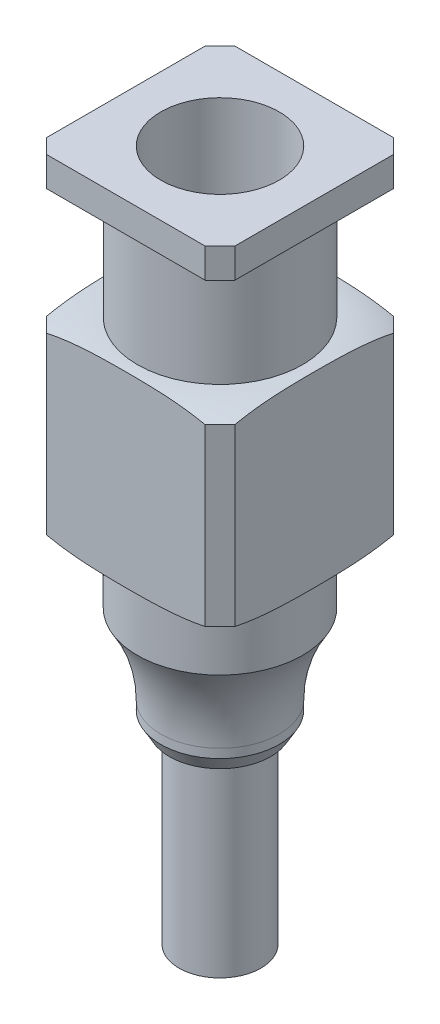
from build123d import *

# Parameters (mm, degrees)
FILLET1_R           = 5
CHAMFER2_SIZE       = 0.5
CHAMFER2_SIZE2      = 0.288675135
BOSS_EXTRUDE1_START = 12
SKETCH2_W           = 6.35
SKETCH2_H           = 6.35
BOSS_EXTRUDE1_DEPTH = 6.35
CHAMFER1_SIZE       = 0.5
BOSS_EXTRUDE3_DEPTH = 1
SKETCH5_R           = 2
CUT_EXTRUDE1_DEPTH  = 11
SKETCH6_R           = 1.0795
CUT_EXTRUDE2_DEPTH  = 14.140918966
CHAMFER3_SIZE       = 0.5


with BuildPart() as part:
    # Sketch1 → Revolve1 (revolve)
    with BuildSketch(Plane.XY, mode=Mode.PRIVATE) as revolve1_sk:
        Polygon((0, 0), (1.3843, 0), (1.3843, 6.35), (2, 6.35), (2, 9.85), (2.79, 9.85), (2.79, 23.35), (0, 23.35), align=None)
    revolve(revolve1_sk.sketch.rotate(Axis((0, 0, 0), (0, 1, 0)), 90), axis=Axis((0, 0, 0), (0, 1, 0)))

    # Fillet1
    # the kernel refuses this fillet: 5 mm, written as the material it adds along each edge
    with BuildSketch(Plane(origin=(0, 9.85, 0), x_dir=(0, 0, -1), z_dir=(1, 0, 0))) as fillet1_piece_1:
        with BuildLine():
            CenterArc((7, -2.697387625), FILLET1_R, 147.351921209, 32.648078791)
            Line((2.79, 0), (2, 0))
            Line((2, 0), (2, -2.697387625))
        make_face()
    revolve(axis=Axis((0, 9.85, 0), (0, 1, 0)))

    # Chamfer2
    chamfer2_edges = [part.edges().sort_by_distance(p)[0] for p in [
        (0, 6.35, 2),
    ]]
    chamfer2_side = [part.faces().sort_by_distance(p)[0] for p in [
        (0, 6.751306187, 2),
    ]]
    chamfer(chamfer2_edges, length=CHAMFER2_SIZE, length2=CHAMFER2_SIZE2, reference=chamfer2_side[0])

    # Sketch2 → Boss-Extrude1 (add)
    with BuildSketch(Plane(origin=(0, 0, 0), x_dir=(1, 0, 0), z_dir=(0, 1, 0)).offset(BOSS_EXTRUDE1_START)):
        Rectangle(SKETCH2_W, SKETCH2_H)
    extrude(amount=BOSS_EXTRUDE1_DEPTH)

    # Sketch3 → Cut-Revolve1 (revolve, cut)
    with BuildSketch(Plane.XY, mode=Mode.PRIVATE) as cut_revolve1_sk:
        with BuildLine():
            Line((-4.79, 17.85), (-4.79, 18.35))
            Line((-4.79, 18.35), (-2.79, 18.35))
            ThreePointArc((-2.79, 18.35), (-3.820776406, 18.223105626), (-4.79, 17.85))
        make_face()
        with BuildLine():
            Line((-4.79, 12.5), (-4.79, 12))
            Line((-4.79, 12), (-2.79, 12))
            ThreePointArc((-2.79, 12), (-3.820776406, 12.126894374), (-4.79, 12.5))
        make_face()
    revolve(cut_revolve1_sk.sketch.rotate(Axis((0, 23.35, 0), (0, -1, 0)), 270), axis=Axis((0, 23.35, 0), (0, -1, 0)), mode=Mode.SUBTRACT)

    # Chamfer1
    chamfer1_edges = [part.edges().sort_by_distance(p)[0] for p in [
        (-3.175, 15.175, -3.175),
        (3.175, 15.175, -3.175),
        (3.175, 15.175, 3.175),
        (-3.175, 15.175, 3.175),
    ]]
    chamfer(chamfer1_edges, length=CHAMFER1_SIZE)

    # Sketch4 → Boss-Extrude3 (add)
    with BuildSketch(Plane(origin=(0, 23.35, 0), x_dir=(1, 0, 0), z_dir=(0, 1, 0))):
        Polygon((-3.175, 2.675), (-3.175, -2.675), (-2.675, -3.175), (2.675, -3.175), (3.175, -2.675), (3.175, 2.675), (2.675, 3.175), (-2.675, 3.175), align=None)
    extrude(amount=-BOSS_EXTRUDE3_DEPTH)

    # Sketch5 → Cut-Extrude1 (cut)
    with BuildSketch(Plane(origin=(0, 23.35, 0), x_dir=(1, 0, 0), z_dir=(0, 1, 0))):
        with Locations(Location((0, 0, 0), (0, 0, 90))):
            Circle(SKETCH5_R)
    extrude(amount=-CUT_EXTRUDE1_DEPTH, mode=Mode.SUBTRACT)

    # Sketch6 → Cut-Extrude2 (cut, through all)
    with BuildSketch(Plane(origin=(0, 12.35, 0), x_dir=(1, 0, 0), z_dir=(0, 1, 0))):
        with Locations(Location((0, 0, 0), (0, 0, 270))):
            Circle(SKETCH6_R)
    extrude(amount=-CUT_EXTRUDE2_DEPTH, mode=Mode.SUBTRACT)

    # Chamfer3
    chamfer3_edges = [part.edges().sort_by_distance(p)[0] for p in [
        (0, 12.35, -1.0795),
    ]]
    chamfer(chamfer3_edges, length=CHAMFER3_SIZE)


solid = part.part
